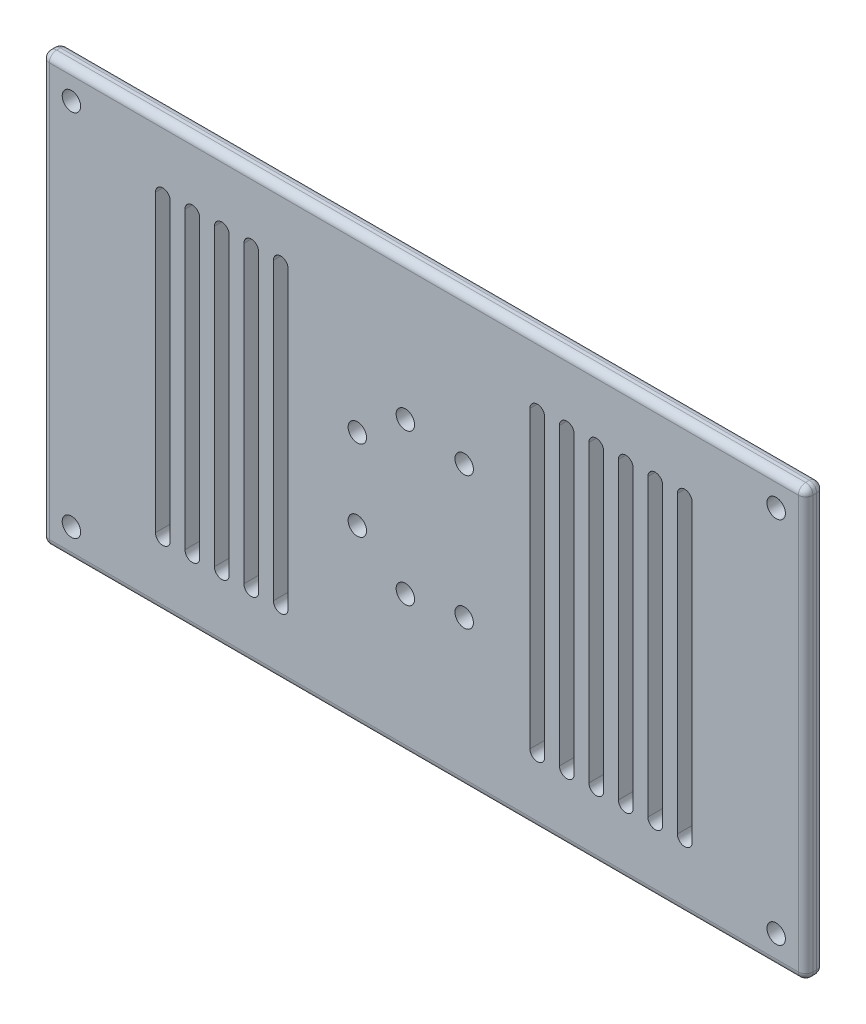
from build123d import *

# Parameters (mm, degrees)
ESQUISSE1_W                                   = 103.6
ESQUISSE1_H                                   = 58
BOSS_EXTRU_1_DEPTH                            = 2.5
CONG_3_R                                      = 1
ESQUISSE17_R                                  = 3
BOSS_EXTRU_12_DEPTH                           = 7
ESQUISSE40_R                                  = 3
BOSS_EXTRU_8_DEPTH                            = 7
ESQUISSE42_R                                  = 3
BOSS_EXTRU_10_DEPTH                           = 7
ENL_V_MAT_EXTRU_2_DEPTH                       = 60.776584044
R_P_TITION_LIN_AIRE1_COUNT                    = 6
R_P_TITION_LIN_AIRE1_PITCH                    = 4
ENL_V_MAT_EXTRU_3_DEPTH                       = 60.776584044
R_P_TITION_LIN_AIRE2_COUNT                    = 5
R_P_TITION_LIN_AIRE2_PITCH                    = 4
TROU_POUR_TARAUDAGE_POUR_TROU_TARAUD_M3_D     = 2.5
TROU_POUR_TARAUDAGE_POUR_TROU_TARAUD_M3_DEPTH = 5
TROU_POUR_TARAUDAGE_POUR_TROU_TARAUD_M3_TIP   = 0.751075774
TROU_POUR_TARAUDAGE_POUR_TROU_TARAUD_2_D      = 2.5
TROU_POUR_TARAUDAGE_POUR_TROU_TARAUD_2_DEPTH  = 5
TROU_POUR_TARAUDAGE_POUR_TROU_TARAUD_2_TIP    = 0.751075774
TROU_POUR_TARAUDAGE_POUR_TROU_TARAUD_3_D      = 2.5
TROU_POUR_TARAUDAGE_POUR_TROU_TARAUD_3_DEPTH  = 5
TROU_POUR_TARAUDAGE_POUR_TROU_TARAUD_3_TIP    = 0.751075774
CONG_4_R                                      = 0.5
TROU_POUR_TARAUDAGE_POUR_TROU_TARAUD_4_D      = 2.5
TROU_POUR_TARAUDAGE_POUR_TROU_TARAUD_4_DEPTH  = 5
TROU_POUR_TARAUDAGE_POUR_TROU_TARAUD_4_TIP    = 0.751075774


with BuildPart() as part:
    # Esquisse1 → Boss.-Extru.1 (new body)
    with BuildSketch(Plane.XY):
        Rectangle(ESQUISSE1_W, ESQUISSE1_H)
    extrude(amount=BOSS_EXTRU_1_DEPTH)

    # Congé3
    cong_3_edges = [part.edges().sort_by_distance(p)[0] for p in [
        (-51.8, 0, 2.5),
        (0, -29, 2.5),
        (0, 29, 2.5),
        (51.8, 0, 2.5),
        (51.8, -29, 1.25),
        (51.8, 29, 1.25),
        (-51.8, 29, 1.25),
        (-51.8, -29, 1.25),
        (51.8, 0, 0),
        (0, 29, 0),
        (-51.8, 0, 0),
        (0, -29, 0),
    ]]
    fillet(cong_3_edges, radius=CONG_3_R)

    # Esquisse17 → Boss.-Extru.12 (add)
    with BuildSketch(Plane.XY.offset(2.5)):
        with Locations((-2.5, 10.25)):
            Circle(ESQUISSE17_R)
        with Locations((-2.5, -10.25)):
            Circle(ESQUISSE17_R)
    extrude(amount=-BOSS_EXTRU_12_DEPTH)

    # Esquisse40 → Boss.-Extru.8 (add)
    with BuildSketch(Plane.XY.offset(2.5)):
        with Locations((5.480077554, -9.01561146)):
            Circle(ESQUISSE40_R)
        with Locations((-9.01561146, 5.480077554)):
            Circle(ESQUISSE40_R)
    extrude(amount=-BOSS_EXTRU_8_DEPTH)

    # Esquisse42 → Boss.-Extru.10 (add)
    with BuildSketch(Plane.XY.offset(2.5)):
        with Locations((-9.01561146, -5.480077554)):
            Circle(ESQUISSE42_R)
        with Locations((5.480077554, 9.01561146)):
            Circle(ESQUISSE42_R)
    extrude(amount=-BOSS_EXTRU_10_DEPTH)

    # Esquisse36 → Enlèv. mat.-Extru.2 (cut, through all)
    with BuildSketch(Plane.XY.offset(2.5)):
        with BuildLine():
            Line((36.4, 20), (36.4, -20))
            ThreePointArc((36.4, -20), (35.4, -21), (34.4, -20))
            Line((34.4, -20), (34.4, 20))
            ThreePointArc((34.4, 20), (35.4, 21), (36.4, 20))
        make_face()
    enl_v_mat_extru_2 = extrude(amount=-ENL_V_MAT_EXTRU_2_DEPTH, mode=Mode.SUBTRACT)

    # Répétition linéaire1: Enlèv. mat.-Extru.2 ×6
    with Locations(*[(-i * R_P_TITION_LIN_AIRE1_PITCH, 0, 0) for i in range(1, R_P_TITION_LIN_AIRE1_COUNT)]):
        add(enl_v_mat_extru_2, mode=Mode.SUBTRACT)

    # Esquisse37 → Enlèv. mat.-Extru.3 (cut, through all)
    with BuildSketch(Plane.XY.offset(2.5)):
        with BuildLine():
            Line((-34.4, 20), (-34.4, -20))
            ThreePointArc((-34.4, -20), (-35.4, -21), (-36.4, -20))
            Line((-36.4, -20), (-36.4, 20))
            ThreePointArc((-36.4, 20), (-35.4, 21), (-34.4, 20))
        make_face()
    enl_v_mat_extru_3 = extrude(amount=-ENL_V_MAT_EXTRU_3_DEPTH, mode=Mode.SUBTRACT)

    # Répétition linéaire2: Enlèv. mat.-Extru.3 ×5
    with Locations(*[(i * R_P_TITION_LIN_AIRE2_PITCH, 0, 0) for i in range(1, R_P_TITION_LIN_AIRE2_COUNT)]):
        add(enl_v_mat_extru_3, mode=Mode.SUBTRACT)

    # Trou pour taraudage pour trou taraud_ M3
    with Locations(Plane(origin=(5.480077554, -9.01561146, 2.5), x_dir=(1, 0, 0), z_dir=(0, 0, 1))):
        with Locations((0, 0), (-14.495689014, 14.495689014)):
            Hole(TROU_POUR_TARAUDAGE_POUR_TROU_TARAUD_M3_D / 2, depth=TROU_POUR_TARAUDAGE_POUR_TROU_TARAUD_M3_DEPTH)
            with Locations((0, 0, -(TROU_POUR_TARAUDAGE_POUR_TROU_TARAUD_M3_DEPTH + TROU_POUR_TARAUDAGE_POUR_TROU_TARAUD_M3_TIP / 2))):  # 118° drill point
                Cone(0, TROU_POUR_TARAUDAGE_POUR_TROU_TARAUD_M3_D / 2, TROU_POUR_TARAUDAGE_POUR_TROU_TARAUD_M3_TIP, mode=Mode.SUBTRACT)

    # Trou pour taraudage pour trou taraud 2
    with Locations(Plane(origin=(5.480077554, 9.01561146, 2.5), x_dir=(1, 0, 0), z_dir=(0, 0, 1))):
        with Locations((0, 0), (-14.495689014, -14.495689014)):
            Hole(TROU_POUR_TARAUDAGE_POUR_TROU_TARAUD_2_D / 2, depth=TROU_POUR_TARAUDAGE_POUR_TROU_TARAUD_2_DEPTH)
            with Locations((0, 0, -(TROU_POUR_TARAUDAGE_POUR_TROU_TARAUD_2_DEPTH + TROU_POUR_TARAUDAGE_POUR_TROU_TARAUD_2_TIP / 2))):  # 118° drill point
                Cone(0, TROU_POUR_TARAUDAGE_POUR_TROU_TARAUD_2_D / 2, TROU_POUR_TARAUDAGE_POUR_TROU_TARAUD_2_TIP, mode=Mode.SUBTRACT)

    # Trou pour taraudage pour trou taraud 3
    with Locations(Plane(origin=(-2.5, 10.25, 2.5), x_dir=(1, 0, 0), z_dir=(0, 0, 1))):
        with Locations((0, 0), (0, -20.5)):
            Hole(TROU_POUR_TARAUDAGE_POUR_TROU_TARAUD_3_D / 2, depth=TROU_POUR_TARAUDAGE_POUR_TROU_TARAUD_3_DEPTH)
            with Locations((0, 0, -(TROU_POUR_TARAUDAGE_POUR_TROU_TARAUD_3_DEPTH + TROU_POUR_TARAUDAGE_POUR_TROU_TARAUD_3_TIP / 2))):  # 118° drill point
                Cone(0, TROU_POUR_TARAUDAGE_POUR_TROU_TARAUD_3_D / 2, TROU_POUR_TARAUDAGE_POUR_TROU_TARAUD_3_TIP, mode=Mode.SUBTRACT)

    # Congé4
    cong_4_edges = [part.edges().sort_by_distance(p)[0] for p in [
        (-5.5, -10.25, 0),
        (-5.5, -10.25, -4.5),
        (-5.5, 10.25, 0),
        (-5.5, 10.25, -4.5),
        (2.480077554, -9.01561146, -4.5),
        (2.480077554, 9.01561146, -4.5),
        (-12.01561146, 5.480077554, 0),
        (-12.01561146, 5.480077554, -4.5),
        (-12.01561146, -5.480077554, 0),
        (-12.01561146, -5.480077554, -4.5),
        (2.480077554, 9.01561146, 0),
        (2.480077554, -9.01561146, 0),
    ]]
    fillet(cong_4_edges, radius=CONG_4_R)

    # Trou pour taraudage pour trou taraud 4
    with Locations(Plane(origin=(-47.8, 25, 2.5), x_dir=(1, 0, 0), z_dir=(0, 0, 1))):
        with Locations((0, 0), (0, -50), (95.6, -50), (95.6, 0)):
            Hole(TROU_POUR_TARAUDAGE_POUR_TROU_TARAUD_4_D / 2, depth=TROU_POUR_TARAUDAGE_POUR_TROU_TARAUD_4_DEPTH)
            with Locations((0, 0, -(TROU_POUR_TARAUDAGE_POUR_TROU_TARAUD_4_DEPTH + TROU_POUR_TARAUDAGE_POUR_TROU_TARAUD_4_TIP / 2))):  # 118° drill point
                Cone(0, TROU_POUR_TARAUDAGE_POUR_TROU_TARAUD_4_D / 2, TROU_POUR_TARAUDAGE_POUR_TROU_TARAUD_4_TIP, mode=Mode.SUBTRACT)


solid = part.part
